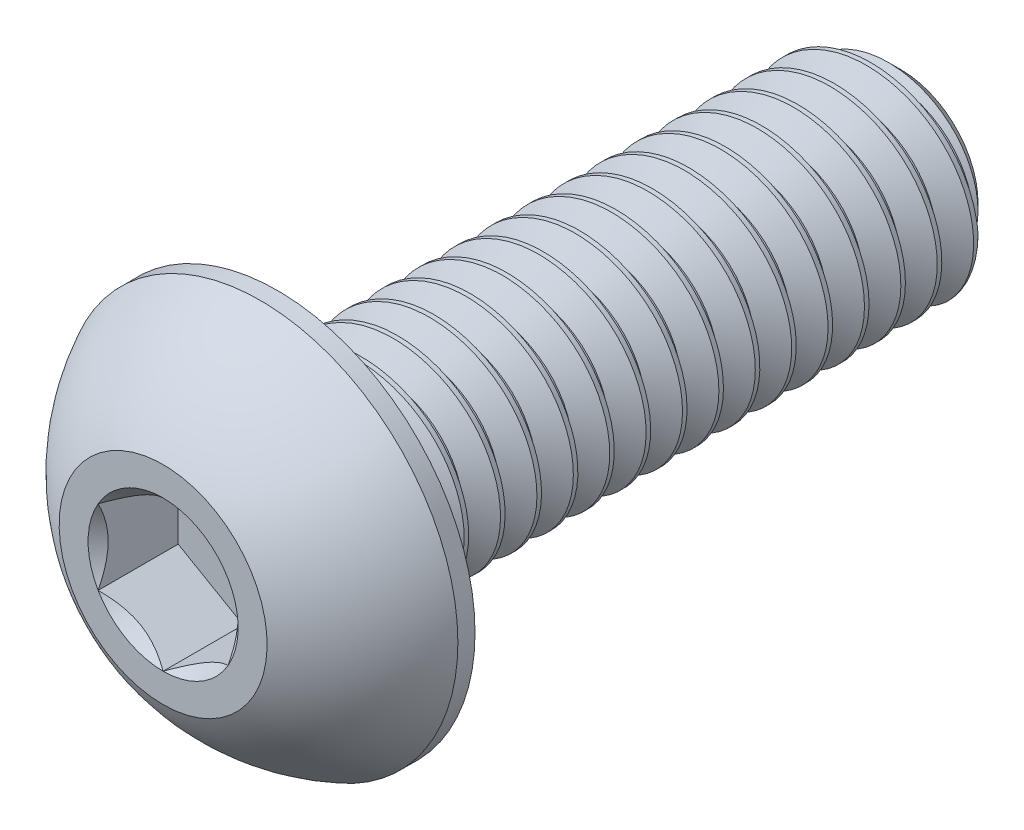
from build123d import *

# Parameters (mm, degrees)
SKETCH1_W          = 12
SKETCH1_H          = 2
CHAMFER1_SIZE      = 0.525
CUT_SWEEP1_PITCH   = 0.7
CUT_EXTRUDE2_DEPTH = 1.54


with BuildPart() as part:
    # Sketch1 → Revolve1 (revolve)
    with BuildSketch(Plane(origin=(0, 0, 0), x_dir=(0, 0, -1), z_dir=(1, 0, 0))):
        with Locations((8.2, 1)):
            Rectangle(SKETCH1_W, SKETCH1_H)
    revolve(axis=Axis((0, 0, -14.2), (0, 0, 1)))

    # Chamfer1
    chamfer1_edges = [part.edges().sort_by_distance(p)[0] for p in [
        (0, -2, -14.2),
    ]]
    chamfer(chamfer1_edges, length=CHAMFER1_SIZE)

    # Cut-Sweep1: the profile of Sketch2 profile screwed along a right-hand helix of 18.142857 turns, 6 arcs to a turn; built about Z, then put on its axis
    cut_sweep1_z = Axis((0, 0, 0), (0, 0, 1))
    cut_sweep1_corners = [(2.0003, 0, 0.000173205), (2.0003, 0, -0.612673205), (1.545336663, 0, -0.35), (1.545336663, 0, -0.2625)]
    with BuildLine(mode=Mode.PRIVATE) as cut_sweep1_profile:
        Line(cut_sweep1_corners[0], cut_sweep1_corners[1])
        Line(cut_sweep1_corners[1], cut_sweep1_corners[2])
        Line(cut_sweep1_corners[2], cut_sweep1_corners[3])
        Line(cut_sweep1_corners[3], cut_sweep1_corners[0])
    cut_sweep1_cap = Face(cut_sweep1_profile.wire())
    cut_sweep1_turn_angles = [0, 30, 60, 90, 120, 150, 180, 210, 240, 270, 300, 330, 360]
    cut_sweep1_turn_weights = [1, 0.8660254037844387, 1, 0.8660254037844387, 1, 0.8660254037844387, 1, 0.8660254037844387, 1, 0.8660254037844387, 1, 0.8660254037844387, 1]
    cut_sweep1_turn_rails = [Edge.make_bspline([Vector(p[0], p[1], 0).rotate(cut_sweep1_z, cut_sweep1_turn_angles[k]) / cut_sweep1_turn_weights[k] + Vector(0, 0, p[2] + CUT_SWEEP1_PITCH * cut_sweep1_turn_angles[k] / 360) for k in range(13)], [0, 0, 0, 1, 1, 2, 2, 3, 3, 4, 4, 5, 5, 6, 6, 6], 2, cut_sweep1_turn_weights) for p in cut_sweep1_corners]
    cut_sweep1_turn_sides = [Face.make_surface_from_curves(cut_sweep1_turn_rails[p[0]], cut_sweep1_turn_rails[p[1]]) for p in [(0, 1), (1, 2), (2, 3), (3, 0)]]
    cut_sweep1_last_angles = [6480, 6505.714285714, 6531.428571429]
    cut_sweep1_last_weights = [1, 0.9009688679026391, 1]
    cut_sweep1_last_rails = [Edge.make_bspline([Vector(p[0], p[1], 0).rotate(cut_sweep1_z, cut_sweep1_last_angles[k]) / cut_sweep1_last_weights[k] + Vector(0, 0, p[2] + CUT_SWEEP1_PITCH * cut_sweep1_last_angles[k] / 360) for k in range(3)], [0, 0, 0, 1, 1, 1], 2, cut_sweep1_last_weights) for p in cut_sweep1_corners]
    cut_sweep1_last_sides = [Face.make_surface_from_curves(cut_sweep1_last_rails[p[0]], cut_sweep1_last_rails[p[1]]) for p in [(0, 1), (1, 2), (2, 3), (3, 0)]]
    cut_sweep1 = Plane(origin=(0, 0, -14.2), x_dir=(0, 1, 0), z_dir=(0, 0, 1)) * Solid(Shell([*[p.moved(Location((0, 0, CUT_SWEEP1_PITCH * i))) for i in range(18) for p in cut_sweep1_turn_sides], *cut_sweep1_last_sides, cut_sweep1_cap, cut_sweep1_cap.rotate(cut_sweep1_z, 6531.428571429).moved(Location((0, 0, CUT_SWEEP1_PITCH * 6531.428571429 / 360)))]))
    add(cut_sweep1, mode=Mode.SUBTRACT)

    # Sketch7 → Revolve2 (revolve)
    with BuildSketch(Plane(origin=(0, 0, 0), x_dir=(0, 0, -1), z_dir=(1, 0, 0)), mode=Mode.PRIVATE) as revolve2_sk:
        with BuildLine():
            Line((1.87, 3.8), (2.2, 3.8))
            Line((2.2, 3.8), (2.2, 0))
            Line((2.2, 0), (0, 0))
            Line((0, 0), (0, 2))
            ThreePointArc((0, 2), (0.793500147, 3.047002626), (1.87, 3.8))
        make_face()
    revolve(revolve2_sk.sketch.rotate(Axis((0, 0, 0), (0, 0, -1)), 189.336081704), axis=Axis((0, 0, 0), (0, 0, -1)))

    # Sketch5 → Cut-Extrude2 (cut)
    with BuildSketch(Plane.XY):
        Polygon((1.25, -0.721687836), (1.25, 0.721687836), (0, 1.443375673), (-1.25, 0.721687836), (-1.25, -0.721687836), (0, -1.443375673), align=None)
    extrude(amount=-CUT_EXTRUDE2_DEPTH, mode=Mode.SUBTRACT)

    # Cut-Extrude3 cone 1 section (through the dimple's axis) → Cut-Extrude3 (revolve, cut)
    with BuildSketch(Plane(origin=(0, 0, 0), x_dir=(0, -1, 0), z_dir=(1, 0, 0))):
        Polygon((0, 0), (1.443375673, 0), (0, 1.443375673), align=None)
    revolve(axis=Axis((0, 0, 0), (0, 0, -1)), mode=Mode.SUBTRACT)


solid = part.part
